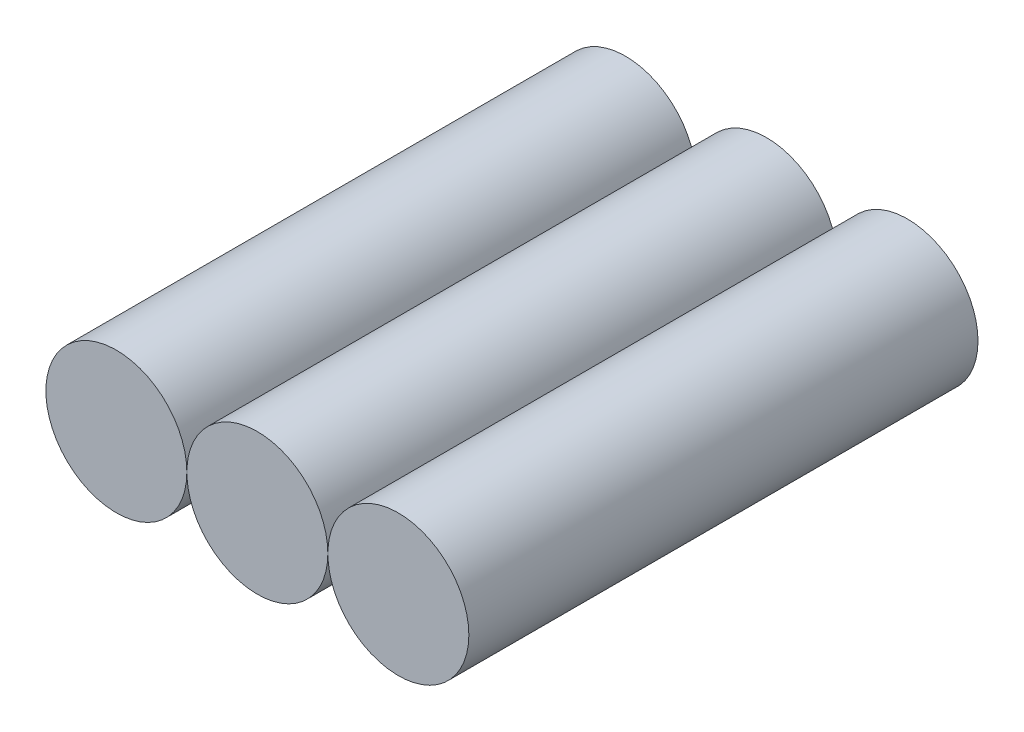
from build123d import *

# Parameters (mm, degrees)
IZIM1_R                       = 9
Y_KSEKLIK_EKSTR_ZYON1_DEPTH   = 65
Y_KSEKLIK_EKSTR_ZYON1_2_DEPTH = 65
Y_KSEKLIK_EKSTR_ZYON1_3_DEPTH = 65


with BuildPart() as part:
    # Çizim1 → Yükseklik-Ekstrüzyon1 (new body)
    with BuildSketch(Plane.XY):
        with Locations((-27.032158746, 0)):
            Circle(IZIM1_R)
    extrude(amount=Y_KSEKLIK_EKSTR_ZYON1_DEPTH)


with BuildPart() as body_2:
    # Çizim1 → Y_kseklik-Ekstr_zyon1 2 (new body)
    with BuildSketch(Plane.XY):
        with Locations((8.967841254, 0)):
            Circle(IZIM1_R)
    extrude(amount=Y_KSEKLIK_EKSTR_ZYON1_2_DEPTH)


with BuildPart() as body_3:
    # Çizim1 → Y_kseklik-Ekstr_zyon1 3 (new body)
    with BuildSketch(Plane.XY):
        with BuildLine():
            ThreePointArc((-0.032158746, 0), (-9.032158746, 9), (-18.032158746, 0))
            ThreePointArc((-18.032158746, 0), (-9.032158746, -9), (-0.032158746, 0))
        make_face()
    extrude(amount=Y_KSEKLIK_EKSTR_ZYON1_3_DEPTH)


solid = Compound([part.part, body_2.part, body_3.part])
